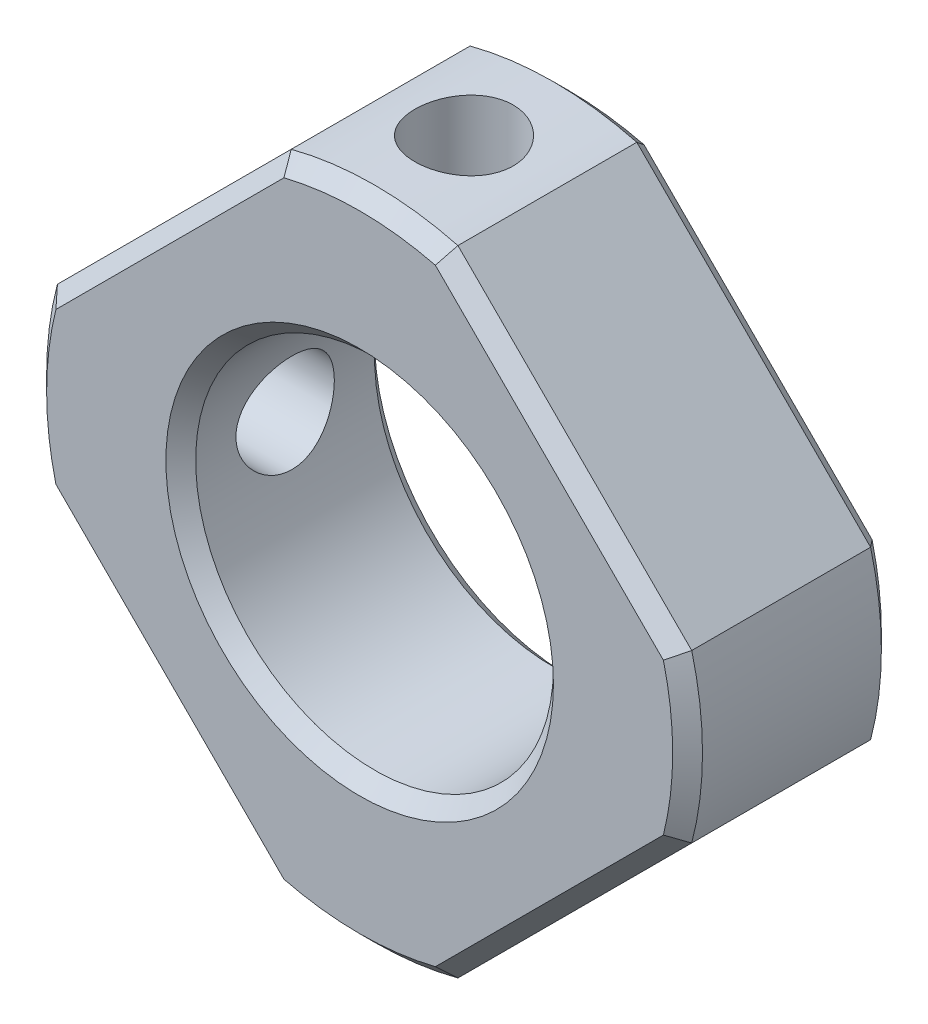
from build123d import *

# Parameters (mm, degrees)
SKETCH1_R           = 6
BOSS_EXTRUDE1_DEPTH = 3.5
SKETCH2_OUTSIDE_W   = 36.598
SKETCH2_OUTSIDE_H   = 36.598
SKETCH2_OUTSIDE_R   = 11
CUT_EXTRUDE1_DEPTH  = 21.248456731
SKETCH4_R           = 1.65
CUT_EXTRUDE2_DEPTH  = 16.945218719
SKETCH5_R           = 1.65
CUT_EXTRUDE3_DEPTH  = 16.945218829
CHAMFER1_SIZE       = 0.5


with BuildPart() as part:
    # Sketch1 → Boss-Extrude1 (new, symmetric)
    with BuildSketch(Plane.XY):
        Polygon((0, -13.435028843), (-13.435028843, 0), (0, 13.435028843), (13.435028843, 0), align=None)
        Circle(SKETCH1_R, mode=Mode.SUBTRACT)
    extrude(amount=BOSS_EXTRUDE1_DEPTH, both=True)

    # Sketch2 outside → Cut-Extrude1 (cut, through all)
    with BuildSketch(Plane.XY.offset(3.5)):
        Rectangle(SKETCH2_OUTSIDE_W, SKETCH2_OUTSIDE_H)
        Circle(SKETCH2_OUTSIDE_R, mode=Mode.SUBTRACT)
    extrude(amount=-CUT_EXTRUDE1_DEPTH, mode=Mode.SUBTRACT)

    # Sketch4 → Cut-Extrude2 (cut, through all)
    with BuildSketch(Plane(origin=(0, 0, 0), x_dir=(1, 0, 0), z_dir=(0, 1, 0))):
        Circle(SKETCH4_R)
    extrude(amount=CUT_EXTRUDE2_DEPTH, mode=Mode.SUBTRACT)

    # Sketch5 → Cut-Extrude3 (cut, through all)
    with BuildSketch(Plane(origin=(0, 0, 0), x_dir=(0, 0, -1), z_dir=(1, 0, 0))):
        Circle(SKETCH5_R)
    extrude(amount=-CUT_EXTRUDE3_DEPTH, mode=Mode.SUBTRACT)

    # Chamfer1
    chamfer1_edges = [part.edges().sort_by_distance(p)[0] for p in [
        (-6.717514421, 6.717514421, -3.5),
        (-11, 0, -3.5),
        (-6.717514421, -6.717514421, -3.5),
        (0, -11, -3.5),
        (6.717514421, -6.717514421, -3.5),
        (11, 0, -3.5),
        (6.717514421, 6.717514421, -3.5),
        (0, 11, -3.5),
        (-6, 0, -3.5),
        (11, 0, 3.5),
        (6.717514421, -6.717514421, 3.5),
        (0, -11, 3.5),
        (-6.717514421, -6.717514421, 3.5),
        (-11, 0, 3.5),
        (-6.717514421, 6.717514421, 3.5),
        (0, 11, 3.5),
        (6.717514421, 6.717514421, 3.5),
        (-6, 0, 3.5),
    ]]
    chamfer(chamfer1_edges, length=CHAMFER1_SIZE)


solid = part.part
